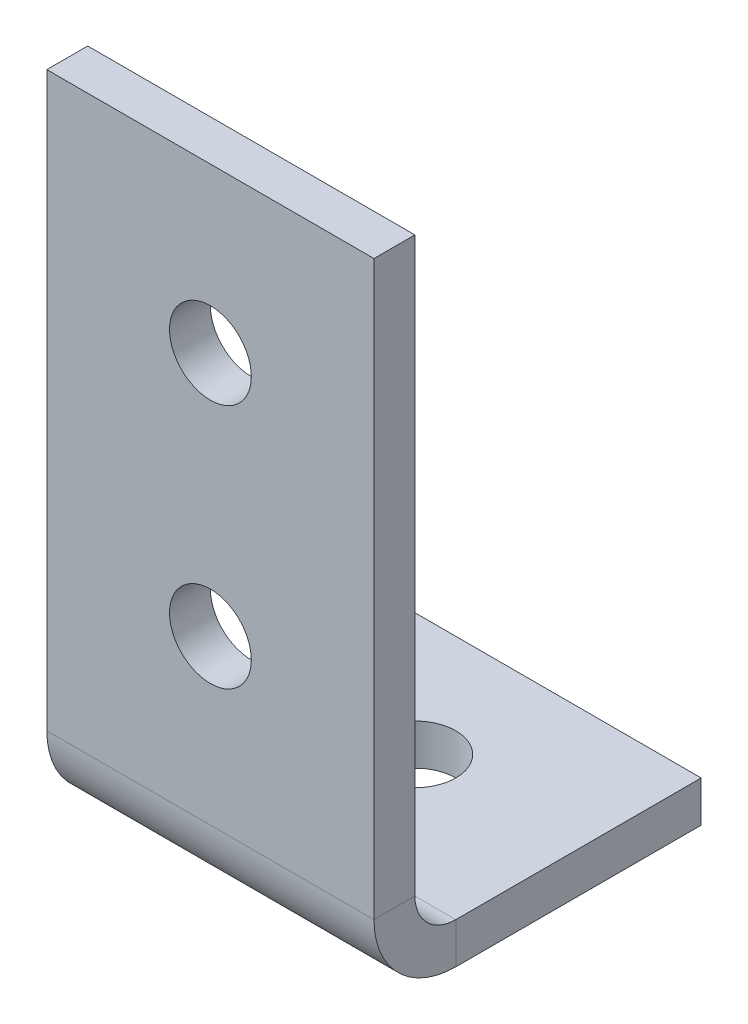
from build123d import *

# Parameters (mm, degrees)
BASE_FLANGE1_DEPTH              = 25.4
F_1_4_0_25_DIAMETER_HOLE1_D     = 6.35
F_1_4_0_25_DIAMETER_HOLE1_DEPTH = 10.7188
F_1_4_0_25_DIAMETER_HOLE1_TIP   = 1.907732465
F_1_4_0_25_DIAMETER_HOLE2_D     = 6.35
F_1_4_0_25_DIAMETER_HOLE2_DEPTH = 10.7188
F_1_4_0_25_DIAMETER_HOLE2_TIP   = 1.907732465


# Sheet-metal steps are written as plain solids
with BuildPart() as part:
    # Sketch1 → Base-Flange1 (new body)
    with BuildSketch(Plane(origin=(0, 0, 0), x_dir=(0, 0, -1), z_dir=(1, 0, 0))):
        with BuildLine():
            Line((0, 0), (-19.05, 0))
            ThreePointArc((-19.05, 0), (-23.540128061, 1.859871939), (-25.4, 6.35))
            Line((-25.4, 6.35), (-25.4, 50.8))
            Line((-25.4, 50.8), (-22.225, 50.8))
            Line((-22.225, 50.8), (-22.225, 6.35))
            ThreePointArc((-22.225, 6.35), (-21.29506403, 4.10493597), (-19.05, 3.175))
            Line((-19.05, 3.175), (0, 3.175))
            Line((0, 3.175), (0, 0))
        make_face()
    extrude(amount=BASE_FLANGE1_DEPTH)

    # 1/4 (0.25) Diameter Hole1
    with Locations(Plane(origin=(0, 0, 22.225), x_dir=(-1, 0, 0), z_dir=(0, 0, -1))):
        with Locations((-12.7, 38.1), (-12.7, 19.05)):
            Hole(F_1_4_0_25_DIAMETER_HOLE1_D / 2, depth=F_1_4_0_25_DIAMETER_HOLE1_DEPTH)
            with Locations((0, 0, -(F_1_4_0_25_DIAMETER_HOLE1_DEPTH + F_1_4_0_25_DIAMETER_HOLE1_TIP / 2))):  # 118° drill point
                Cone(0, F_1_4_0_25_DIAMETER_HOLE1_D / 2, F_1_4_0_25_DIAMETER_HOLE1_TIP, mode=Mode.SUBTRACT)

    # 1/4 (0.25) Diameter Hole2
    with Locations(Plane(origin=(0, 3.175, 0), x_dir=(1, 0, 0), z_dir=(0, 1, 0))):
        with Locations((12.7, -9.525)):
            Hole(F_1_4_0_25_DIAMETER_HOLE2_D / 2, depth=F_1_4_0_25_DIAMETER_HOLE2_DEPTH)
            with Locations((0, 0, -(F_1_4_0_25_DIAMETER_HOLE2_DEPTH + F_1_4_0_25_DIAMETER_HOLE2_TIP / 2))):  # 118° drill point
                Cone(0, F_1_4_0_25_DIAMETER_HOLE2_D / 2, F_1_4_0_25_DIAMETER_HOLE2_TIP, mode=Mode.SUBTRACT)


solid = part.part
